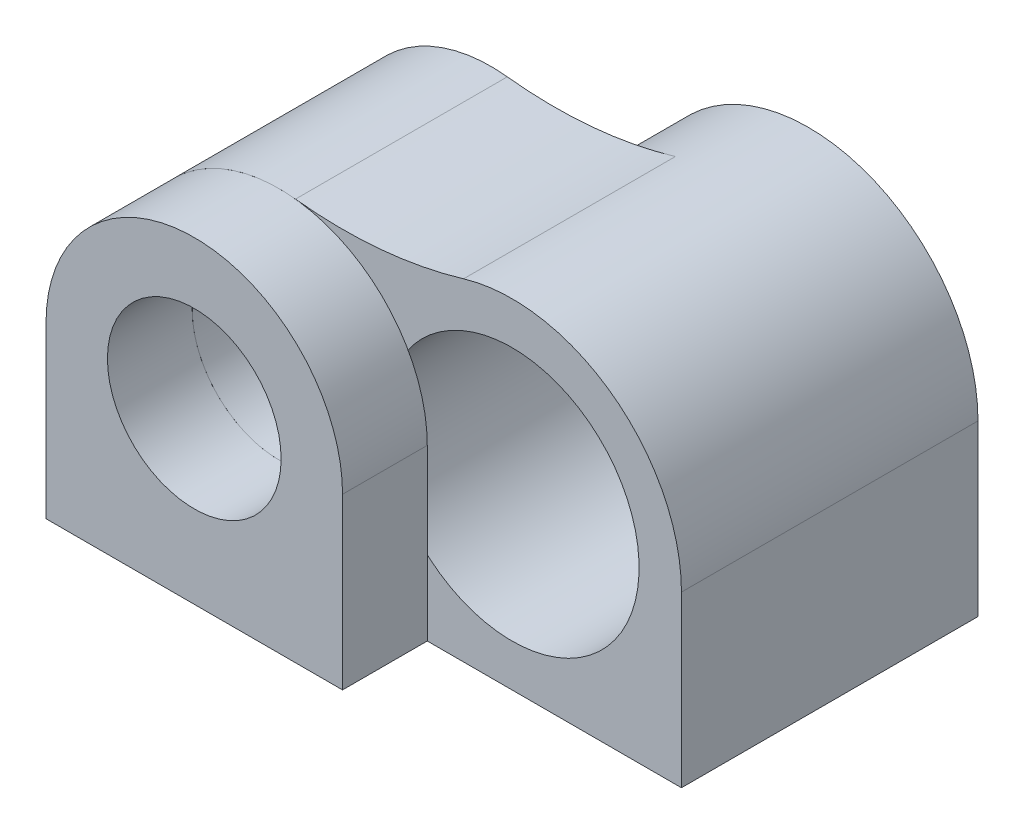
from build123d import *

# Parameters (mm, degrees)
SKETCH1_R           = 3
BOSS_EXTRUDE1_DEPTH = 7
BOSS_EXTRUDE6_START = -3
BOSS_EXTRUDE6_DEPTH = 3
SKETCH2_4_R         = 2.05
BOSS_EXTRUDE8_DEPTH = 2
BOSS_EXTRUDE9_START = -5
BOSS_EXTRUDE9_DEPTH = 2
FILLET2_R           = 10
CUT_EXTRUDE5_START  = -10
SKETCH2_9_R         = 2.05
CUT_EXTRUDE5_DEPTH  = 7


with BuildPart() as part:
    # Sketch1 → Boss-Extrude1 (new body)
    with BuildSketch(Plane.XY):
        with BuildLine():
            Line((-4, 0), (-4, -4))
            Line((-4, -4), (4, -4))
            Line((4, -4), (4, 0))
            ThreePointArc((4, 0), (0, 4), (-4, 0))
        make_face()
        Circle(SKETCH1_R, mode=Mode.SUBTRACT)
    extrude(amount=BOSS_EXTRUDE1_DEPTH)

    # Sketch2 → Boss-Extrude6 (add)
    with BuildSketch(Plane.XY.offset(7).offset(BOSS_EXTRUDE6_START)):
        with BuildLine():
            ThreePointArc((-3.090909091, 2.538952735), (-6.881698559, 3.215728392), (-9, 0))
            Line((-9, 0), (-9, -4))
            Line((-9, -4), (-4, -4))
            Line((-4, -4), (-4, -1.397318861))
            ThreePointArc((-4, -1.397318861), (-7.545149359, 0.140940053), (-3.8225, 1.178343647))
            ThreePointArc((-3.8225, 1.178343647), (-3.523012998, 1.894301827), (-3.090909091, 2.538952735))
        make_face()
    extrude(amount=BOSS_EXTRUDE6_DEPTH)

    # Sketch2<6> → Boss-Extrude9 (add)
    with BuildSketch(Plane.XY.offset(7).offset(BOSS_EXTRUDE9_START)):
        with BuildLine():
            ThreePointArc((-3.090909091, 2.538952735), (-6.881698559, 3.215728392), (-9, 0))
            Line((-9, 0), (-9, -4))
            Line((-9, -4), (-4, -4))
            Line((-4, -4), (-4, -1.397318861))
            ThreePointArc((-4, -1.397318861), (-7.545149359, 0.140940053), (-3.8225, 1.178343647))
            ThreePointArc((-3.8225, 1.178343647), (-3.523012998, 1.894301827), (-3.090909091, 2.538952735))
        make_face()
    extrude(amount=BOSS_EXTRUDE9_DEPTH)

    # Fillet2
    fillet2_edges = [part.edges().sort_by_distance(p)[0] for p in [
        (-3.090909091, 2.538952735, 4.5),
    ]]
    fillet(fillet2_edges, radius=FILLET2_R)

    # Sketch2<9> → Cut-Extrude5 (cut)
    with BuildSketch(Plane.XY.offset(7).offset(CUT_EXTRUDE5_START)):
        with Locations((-5.5, 0)):
            Circle(SKETCH2_9_R)
    extrude(amount=CUT_EXTRUDE5_DEPTH, mode=Mode.SUBTRACT)


with BuildPart() as body_2:
    # Sketch2<4> → Boss-Extrude8 (new body)
    with BuildSketch(Plane.XY.offset(7)):
        with BuildLine():
            Line((-9, 0), (-9, -4))
            Line((-9, -4), (-2, -4))
            Line((-2, -4), (-2, 0))
            ThreePointArc((-2, 0), (-5.5, 3.5), (-9, 0))
        make_face()
        with Locations((-5.5, 0)):
            Circle(SKETCH2_4_R, mode=Mode.SUBTRACT)
    extrude(amount=BOSS_EXTRUDE8_DEPTH)


solid = Compound([part.part, body_2.part])
